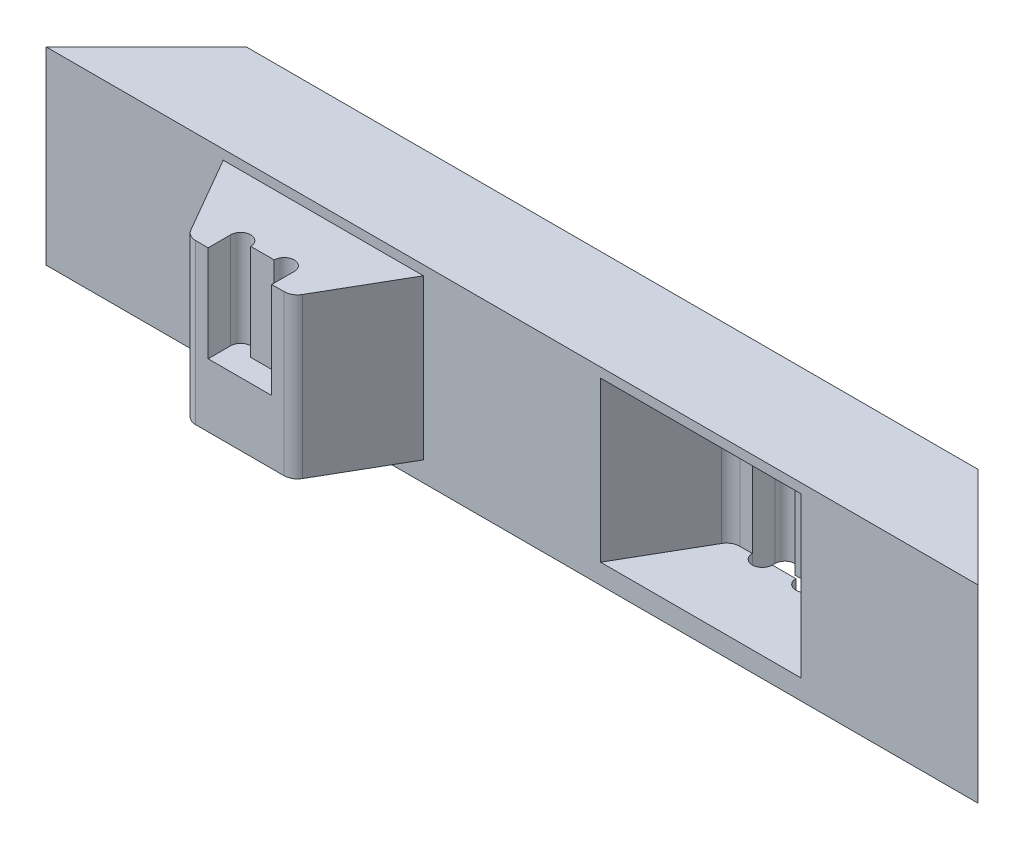
from build123d import *

# Parameters (mm, degrees)
SKETCH1_W           = 139.7
SKETCH1_H           = 20
BOSS_EXTRUDE1_DEPTH = 14.17
CUT_EXTRUDE1_DEPTH  = 23.9
BOSS_EXTRUDE2_DEPTH = 23.9
CHAMFER1_SIZE       = 20
CHAMFER2_SIZE       = 5
CUT_EXTRUDE2_DEPTH  = 14.41
CUT_EXTRUDE3_DEPTH  = 19.02
FILLET1_R           = 2


with BuildPart() as part:
    # Sketch1 → Boss-Extrude1 (new, symmetric)
    with BuildSketch(Plane(origin=(0, 0, 0), x_dir=(1, 0, 0), z_dir=(0, 1, 0))):
        Rectangle(SKETCH1_W, SKETCH1_H)
    extrude(amount=BOSS_EXTRUDE1_DEPTH, both=True)

    # Sketch3 → Cut-Extrude1 (cut)
    with BuildSketch(Plane(origin=(0, -11.17, 0), x_dir=(-1, 0, 0), z_dir=(0, -1, 0))):
        Polygon((-13.283333333, -10), (-20.500211698, 2.5), (-36.066454968, 2.5), (-43.283333333, -10), align=None)
    extrude(amount=-CUT_EXTRUDE1_DEPTH, mode=Mode.SUBTRACT)

    # Sketch4 → Boss-Extrude2 (add)
    with BuildSketch(Plane(origin=(0, -11.17, 0), x_dir=(-1, 0, 0), z_dir=(0, -1, 0))):
        Polygon((43.283333333, -10), (13.283333333, -10), (20.500211698, -22.5), (36.066454968, -22.5), align=None)
    extrude(amount=-BOSS_EXTRUDE2_DEPTH)

    # Chamfer1
    chamfer1_edges = [part.edges().sort_by_distance(p)[0] for p in [
        (69.85, 0, -10),
        (-69.85, 0, -10),
    ]]
    chamfer(chamfer1_edges, length=CHAMFER1_SIZE - 0.0001)  # a hair under: the kernel refuses the full size

    # Chamfer2
    chamfer2_edges = [part.edges().sort_by_distance(p)[0] for p in [
        (0, 14.17, -10),
    ]]
    chamfer(chamfer2_edges, length=CHAMFER2_SIZE)

    # Sketch5 → Cut-Extrude2 (cut)
    with BuildSketch(Plane(origin=(0, 12.73, 0), x_dir=(1, 0, 0), z_dir=(0, 1, 0))):
        with BuildLine():
            Line((-33.048333333, -19.12), (-33.048333333, -22.5))
            Line((-33.048333333, -22.5), (-23.518333333, -22.5))
            Line((-23.518333333, -22.5), (-23.518333333, -19.12))
            ThreePointArc((-23.518333333, -19.12), (-25.018333333, -17.62), (-26.518333333, -19.12))
            Line((-26.518333333, -19.12), (-30.048333333, -19.12))
            ThreePointArc((-30.048333333, -19.12), (-31.548333333, -17.62), (-33.048333333, -19.12))
        make_face()
    extrude(amount=-CUT_EXTRUDE2_DEPTH, mode=Mode.SUBTRACT)

    # Sketch7 → Cut-Extrude3 (cut)
    with BuildSketch(Plane.XZ.offset(14.17)):
        with BuildLine():
            Line((23.518333333, -2.5), (23.518333333, -5.88))
            ThreePointArc((23.518333333, -5.88), (25.018333333, -7.38), (26.518333333, -5.88))
            Line((26.518333333, -5.88), (30.048333333, -5.88))
            ThreePointArc((30.048333333, -5.88), (31.548333333, -7.38), (33.048333333, -5.88))
            Line((33.048333333, -5.88), (33.048333333, -2.5))
            ThreePointArc((33.048333333, -2.5), (31.548333333, -1), (30.048333333, -2.5))
            Line((30.048333333, -2.5), (26.518333333, -2.5))
            ThreePointArc((26.518333333, -2.5), (25.018333333, -1), (23.518333333, -2.5))
        make_face()
    extrude(amount=-CUT_EXTRUDE3_DEPTH, mode=Mode.SUBTRACT)

    # Fillet1
    fillet1_edges = [part.edges().sort_by_distance(p)[0] for p in [
        (36.066454968, 0.78, -2.5),
        (20.500211698, 0.78, -2.5),
        (-36.066454968, 0.78, 22.5),
        (-20.500211698, 0.78, 22.5),
    ]]
    fillet(fillet1_edges, radius=FILLET1_R)


solid = part.part
